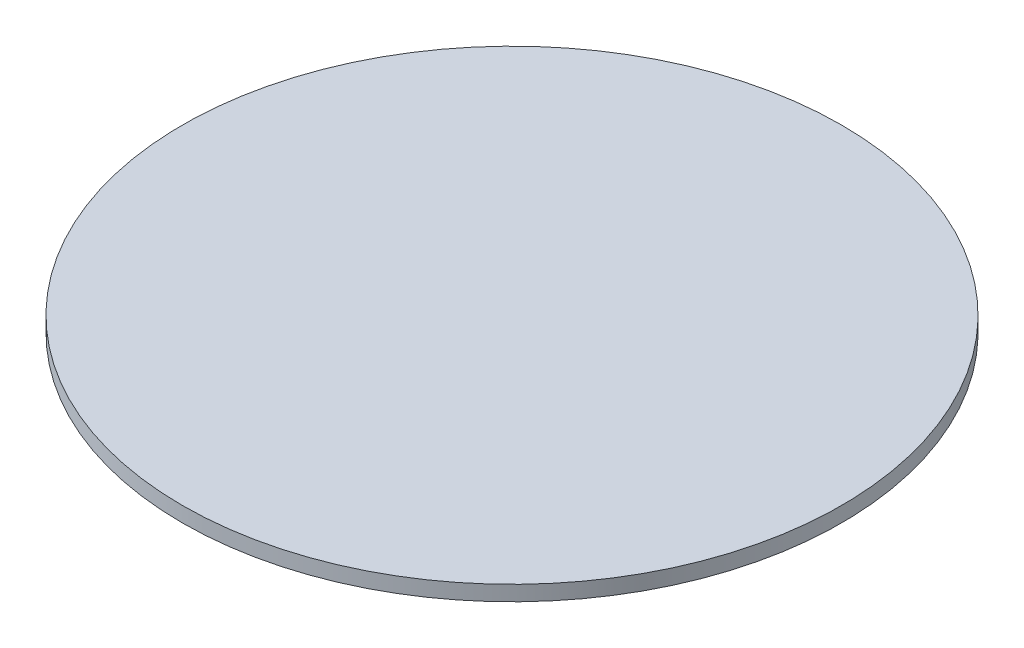
from build123d import *

# Parameters (mm, degrees)
SKETCH1_W          = 30
SKETCH1_H          = 6.9
SKETCH1_W_2        = 2.3
SKETCH1_H_2        = 2.3
BASE_FLANGE1_DEPTH = 2.3
BASE_FLANGE2_DEPTH = 2.3
SKETCH9_R          = 12.5
SKETCH9_R_2        = 1.5
BASE_FLANGE3_DEPTH = 2.3
SKETCH10_R         = 50
BASE_FLANGE4_DEPTH = 2.3


# Sheet-metal steps are written as plain solids
with BuildPart() as part:
    # Sketch1 → Base-Flange1 (new body)
    with BuildSketch(Plane(origin=(0, 0, 0), x_dir=(1, 0, 0), z_dir=(0, 1, 0))):
        with Locations((11.55, 0)):
            Rectangle(SKETCH1_W, SKETCH1_H)
        Rectangle(SKETCH1_W_2, SKETCH1_H_2, mode=Mode.SUBTRACT)
    extrude(amount=-BASE_FLANGE1_DEPTH)


with BuildPart() as body_2:
    # Sketch6 → Base-Flange2 (new body)
    with BuildSketch(Plane(origin=(0, 0, 0), x_dir=(1, 0, 0), z_dir=(0, 1, 0))):
        with BuildLine():
            Line((0, 13.445456408), (2.3, 13.445456408))
            Line((2.3, 13.445456408), (2.3, 11.145456408))
            Line((2.3, 11.145456408), (6.9, 11.145456408))
            Line((6.9, 11.145456408), (6.9, 11.395456408))
            Line((6.9, 11.395456408), (7.656214822, 11.231061881))
            ThreePointArc((7.656214822, 11.231061881), (7.939298992, 11.056235224), (8.05, 10.742473699))
            Line((8.05, 10.742473699), (8.05, 10.245456408))
            Line((8.05, 10.245456408), (4.6, 9.995456408))
            Line((4.6, 9.995456408), (8.05, 9.745456408))
            Line((8.05, 9.745456408), (8.05, 9.248439116))
            ThreePointArc((8.05, 9.248439116), (7.939298992, 8.934677592), (7.656214822, 8.759850934))
            Line((7.656214822, 8.759850934), (6.9, 8.595456408))
            Line((6.9, 8.595456408), (6.9, 8.845456408))
            Line((6.9, 8.845456408), (2.3, 8.845456408))
            Line((2.3, 8.845456408), (2.3, 6.545456408))
            Line((2.3, 6.545456408), (0, 6.545456408))
            Line((0, 6.545456408), (0, 13.445456408))
        make_face()
    extrude(amount=-BASE_FLANGE2_DEPTH)


with BuildPart() as body_3:
    # Sketch9 → Base-Flange3 (new body)
    with BuildSketch(Plane(origin=(0, 0, 0), x_dir=(1, 0, 0), z_dir=(0, 1, 0))):
        with Locations(Location((16.014309717, 23.691171103, 0), (0, 0, 270))):
            Circle(SKETCH9_R)
        with Locations(Location((16.014309717, 23.691171103, 0), (0, 0, 270))):
            Circle(SKETCH9_R_2, mode=Mode.SUBTRACT)
    extrude(amount=-BASE_FLANGE3_DEPTH)


with BuildPart() as body_4:
    # Sketch10 → Base-Flange4 (new body)
    with BuildSketch(Plane(origin=(0, 0, 0), x_dir=(1, 0, 0), z_dir=(0, 1, 0))):
        with Locations(Location((0, 0, 0), (0, 0, 270))):
            Circle(SKETCH10_R)
    extrude(amount=-BASE_FLANGE4_DEPTH)


solid = Compound([part.part, body_2.part, body_3.part, body_4.part])
